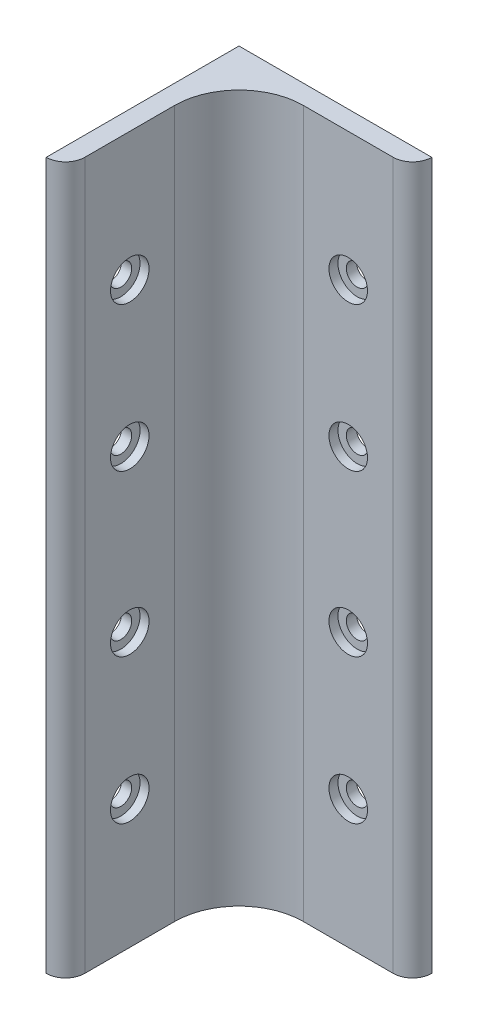
from build123d import *

# Parameters (mm, degrees)
BOSS_EXTRUDE1_DEPTH = 110
FILLET1_R           = 10
FILLET2_R           = 3
SKETCH2_R           = 1.7
CUT_EXTRUDE1_DEPTH  = 118.170815479
SKETCH3_R           = 1.7
CUT_EXTRUDE2_DEPTH  = 118.170815479
SKETCH4_R           = 3
CUT_EXTRUDE3_DEPTH  = 1.4
SKETCH5_R           = 3
CUT_EXTRUDE4_DEPTH  = 1.4


with BuildPart() as part:
    # Sketch1 → Boss-Extrude1 (new body)
    with BuildSketch(Plane(origin=(0, 0, 0), x_dir=(1, 0, 0), z_dir=(0, 1, 0))):
        Polygon((0, 0), (0, -30), (3, -30), (3, -3), (30, -3), (30, 0), align=None)
    extrude(amount=BOSS_EXTRUDE1_DEPTH)

    # Fillet1
    fillet1_edges = [part.edges().sort_by_distance(p)[0] for p in [
        (3, 55, 3),
    ]]
    fillet(fillet1_edges, radius=FILLET1_R)

    # Fillet2
    fillet2_edges = [part.edges().sort_by_distance(p)[0] for p in [
        (3, 55, 30),
        (30, 55, 3),
    ]]
    fillet(fillet2_edges, radius=FILLET2_R - 0.0001)  # a hair under: the kernel refuses the full size

    # Sketch2 → Cut-Extrude1 (cut, through all)
    with BuildSketch(Plane.XY.offset(3)):
        with Locations((20, 90)):
            Circle(SKETCH2_R)
        with Locations(Location((20, 67.5, 0), (0, 0, 180))):
            Circle(SKETCH2_R)
        with Locations((20, 42.5)):
            Circle(SKETCH2_R)
        with Locations(Location((20, 20, 0), (0, 0, 180))):
            Circle(SKETCH2_R)
    extrude(amount=-CUT_EXTRUDE1_DEPTH, mode=Mode.SUBTRACT)

    # Sketch3 → Cut-Extrude2 (cut, through all)
    with BuildSketch(Plane(origin=(3, 0, 0), x_dir=(0, 0, -1), z_dir=(1, 0, 0))):
        with Locations((-20, 90)):
            Circle(SKETCH3_R)
        with Locations(Location((-20, 67.5, 0), (0, 0, 180))):
            Circle(SKETCH3_R)
        with Locations((-20, 42.5)):
            Circle(SKETCH3_R)
        with Locations(Location((-20, 20, 0), (0, 0, 180))):
            Circle(SKETCH3_R)
    extrude(amount=-CUT_EXTRUDE2_DEPTH, mode=Mode.SUBTRACT)

    # Sketch4 → Cut-Extrude3 (cut)
    with BuildSketch(Plane.XY.offset(3)):
        with Locations((20, 90)):
            Circle(SKETCH4_R)
        with Locations(Location((20, 67.5, 0), (0, 0, 180))):
            Circle(SKETCH4_R)
        with Locations((20, 42.5)):
            Circle(SKETCH4_R)
        with Locations(Location((20, 20, 0), (0, 0, 180))):
            Circle(SKETCH4_R)
    extrude(amount=-CUT_EXTRUDE3_DEPTH, mode=Mode.SUBTRACT)

    # Sketch5 → Cut-Extrude4 (cut)
    with BuildSketch(Plane(origin=(3, 0, 0), x_dir=(0, 0, -1), z_dir=(1, 0, 0))):
        with Locations((-20, 90)):
            Circle(SKETCH5_R)
        with Locations(Location((-20, 67.5, 0), (0, 0, 180))):
            Circle(SKETCH5_R)
        with Locations((-20, 42.5)):
            Circle(SKETCH5_R)
        with Locations(Location((-20, 20, 0), (0, 0, 180))):
            Circle(SKETCH5_R)
    extrude(amount=-CUT_EXTRUDE4_DEPTH, mode=Mode.SUBTRACT)


solid = part.part
